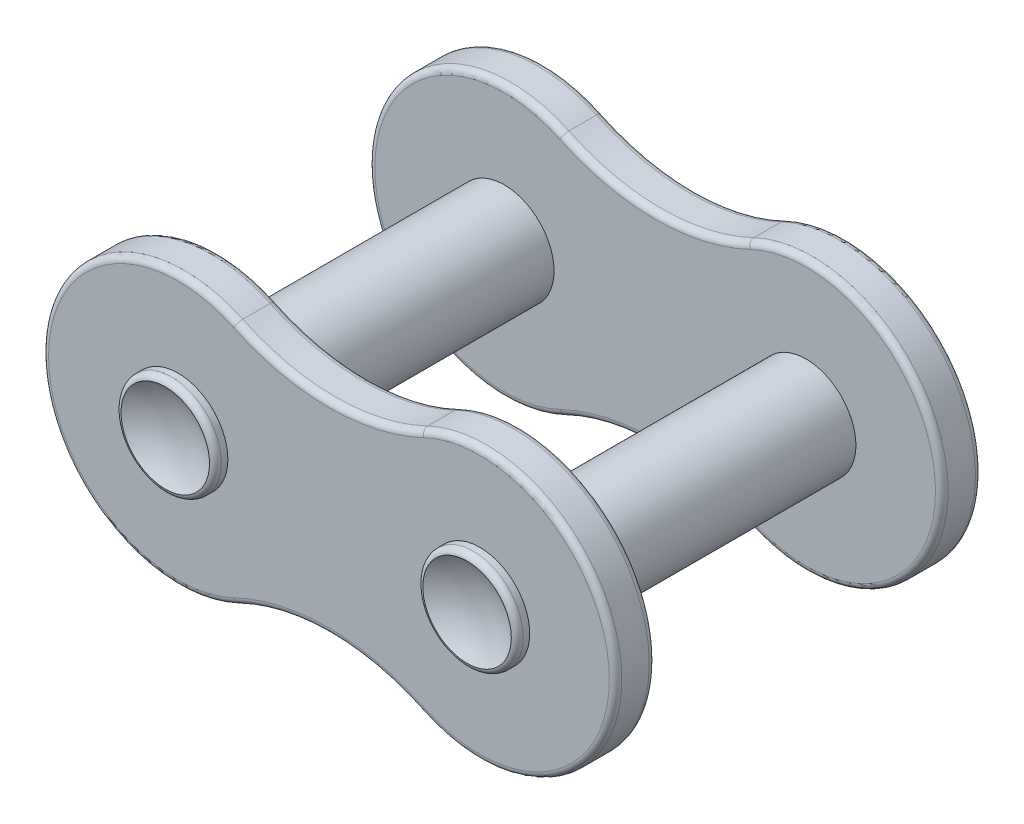
from build123d import *

# Parameters (mm, degrees)
ESBO_O1_R                = 1.9812
RESSALTO_EXTRUS_O1_DEPTH = 1.5875
RESSALTO_EXTRUS_O2_START = -0.508
ESBO_O2_R                = 1.9812
RESSALTO_EXTRUS_O2_DEPTH = 15.573248
FILETE1_R                = 0.25
FILETE2_R                = 0.25


with BuildPart() as part:
    # Esboço1 → Ressalto-extrusão1 (new body)
    with BuildSketch(Plane.XY):
        with BuildLine():
            ThreePointArc((-3.676327125, 4.871709209), (-11.3975, 0), (-3.676327125, -4.871709209))
            ThreePointArc((-3.676327125, -4.871709209), (0, -4.039845582), (3.676327125, -4.871709209))
            ThreePointArc((3.676327125, -4.871709209), (11.3975, 0), (3.676327125, 4.871709209))
            ThreePointArc((3.676327125, 4.871709209), (0, 4.039845582), (-3.676327125, 4.871709209))
        make_face()
        with Locations((-6, 0)):
            Circle(ESBO_O1_R, mode=Mode.SUBTRACT)
        with Locations(Location((6, 0, 0), (0, 0, 180))):
            Circle(ESBO_O1_R, mode=Mode.SUBTRACT)
    ressalto_extrus_o1 = extrude(amount=RESSALTO_EXTRUS_O1_DEPTH)

    # Esboço2 → Ressalto-extrusão2 (add)
    with BuildSketch(Plane.XY.offset(RESSALTO_EXTRUS_O2_START)):
        with Locations((-6, 0)):
            Circle(ESBO_O2_R)
    ressalto_extrus_o2 = extrude(amount=RESSALTO_EXTRUS_O2_DEPTH)

    # Espelhar1: Ressalto-extrusão1 across plane
    add(ressalto_extrus_o1.mirror(Plane.XY.offset(7.278624)))

    # Esboço3 → Corte-Revolução1 (revolve, cut)
    with BuildSketch(Plane(origin=(0, 0, 0), x_dir=(1, 0, 0), z_dir=(0, 1, 0))):
        with BuildLine():
            Line((-6, -14.557248), (-6, -15.319248))
            Line((-6, -15.319248), (-8.109882461, -15.319248))
            ThreePointArc((-8.109882461, -15.319248), (-7.12163363, -14.753585108), (-6, -14.557248))
        make_face()
    corte_revolu_o1 = revolve(axis=Axis((-6, 0, 14.557248), (0, 0, 1)), mode=Mode.SUBTRACT)

    # Espelhar2: Corte-Revolução1 across plane
    add(corte_revolu_o1.mirror(Plane.XY.offset(7.278624)), mode=Mode.SUBTRACT)

    # Espelhar3: Ressalto-extrusão2, Corte-Revolução1 across plane
    add(ressalto_extrus_o2.mirror(Plane(origin=(0, 0, 0), x_dir=(0, 0, 1), z_dir=(1, 0, 0))))
    add(corte_revolu_o1.mirror(Plane(origin=(0, 0, 0), x_dir=(0, 0, 1), z_dir=(1, 0, 0))), mode=Mode.SUBTRACT)

    # Espelhar3 copy 1 sketch → Espelhar3 copy 1 (revolve, cut)
    with BuildSketch(Plane(origin=(0, 0, 14.557248), x_dir=(-1, 0, 0), z_dir=(0, 1, 0))):
        with BuildLine():
            Line((-6, -14.557248), (-6, -15.319248))
            Line((-6, -15.319248), (-8.109882461, -15.319248))
            ThreePointArc((-8.109882461, -15.319248), (-7.12163363, -14.753585108), (-6, -14.557248))
        make_face()
    revolve(axis=Axis((6, 0, 0), (0, 0, -1)), mode=Mode.SUBTRACT)

    # Filete1
    filete1_edges = [part.edges().sort_by_distance(p)[0] for p in [
        (0, -4.039845582, 1.5875),
        (11.3975, 0, 1.5875),
        (0, 4.039845582, 12.969748),
        (11.3975, 0, 12.969748),
        (0, -4.039845582, 12.969748),
        (-11.3975, 0, 12.969748),
        (0, 4.039845582, 14.557248),
        (-11.3975, 0, 14.557248),
        (0, -4.039845582, 14.557248),
        (11.3975, 0, 14.557248),
        (0, 4.039845582, 1.5875),
        (11.3975, 0, 0),
        (0, -4.039845582, 0),
        (-11.3975, 0, 0),
        (0, 4.039845582, 0),
        (-11.3975, 0, 1.5875),
    ]]
    fillet(filete1_edges, radius=FILETE1_R)

    # Filete2
    # the kernel refuses this fillet: 0.25 mm, written as the material it takes off along each edge
    with BuildSketch(Plane(origin=(-6, 0, -0.508), x_dir=(1, 0, 0), z_dir=(0, -1, 0))) as filete2_piece_1:
        with BuildLine():
            CenterArc((1.7312, 0.248362879), FILETE2_R, 276.560626589, 83.439373411)
            Line((1.75976362, 0), (1.760334893, -0.004967258))
            ThreePointArc((1.760334893, -0.004967258), (1.87048181, -0.005), (1.9812, -0.005))
            Line((1.9812, -0.005), (1.9862, 0))
            Line((1.9862, 0), (1.9862, 0.248362879))
            Line((1.9862, 0.248362879), (1.9812, 0.248362879))
        make_face()
    revolve(axis=Axis((-6, 0, -0.508), (0, 0, 1)), mode=Mode.SUBTRACT)
    with BuildSketch(Plane(origin=(-6, 0, 15.065248), x_dir=(1, 0, 0), z_dir=(0, -1, 0))) as filete2_piece_2:
        with BuildLine():
            CenterArc((1.7312, -0.248362879), FILETE2_R, 0, 83.439373411)
            Line((1.75976362, 0), (1.760334893, 0.004967258))
            ThreePointArc((1.760334893, 0.004967258), (1.87048181, 0.005), (1.9812, 0.005))
            Line((1.9812, 0.005), (1.9862, 0))
            Line((1.9862, 0), (1.9862, -0.248362879))
            Line((1.9862, -0.248362879), (1.9812, -0.248362879))
        make_face()
    revolve(axis=Axis((-6, 0, 15.065248), (0, 0, 1)), mode=Mode.SUBTRACT)
    with BuildSketch(Plane(origin=(6, 0, 15.065248), x_dir=(-1, 0, 0), z_dir=(0, -1, 0))) as filete2_piece_3:
        with BuildLine():
            CenterArc((1.7312, 0.248362879), FILETE2_R, 276.560626589, 83.439373411)
            Line((1.75976362, 0), (1.760334893, -0.004967258))
            ThreePointArc((1.760334893, -0.004967258), (1.87048181, -0.005), (1.9812, -0.005))
            Line((1.9812, -0.005), (1.9862, 0))
            Line((1.9862, 0), (1.9862, 0.248362879))
            Line((1.9862, 0.248362879), (1.9812, 0.248362879))
        make_face()
    revolve(axis=Axis((6, 0, 15.065248), (0, 0, -1)), mode=Mode.SUBTRACT)
    with BuildSketch(Plane(origin=(6, 0, -0.508), x_dir=(-1, 0, 0), z_dir=(0, -1, 0))) as filete2_piece_4:
        with BuildLine():
            CenterArc((1.7312, -0.248362879), FILETE2_R, 0, 83.439373411)
            Line((1.75976362, 0), (1.760334893, 0.004967258))
            ThreePointArc((1.760334893, 0.004967258), (1.87048181, 0.005), (1.9812, 0.005))
            Line((1.9812, 0.005), (1.9862, 0))
            Line((1.9862, 0), (1.9862, -0.248362879))
            Line((1.9862, -0.248362879), (1.9812, -0.248362879))
        make_face()
    revolve(axis=Axis((6, 0, -0.508), (0, 0, -1)), mode=Mode.SUBTRACT)


solid = part.part
